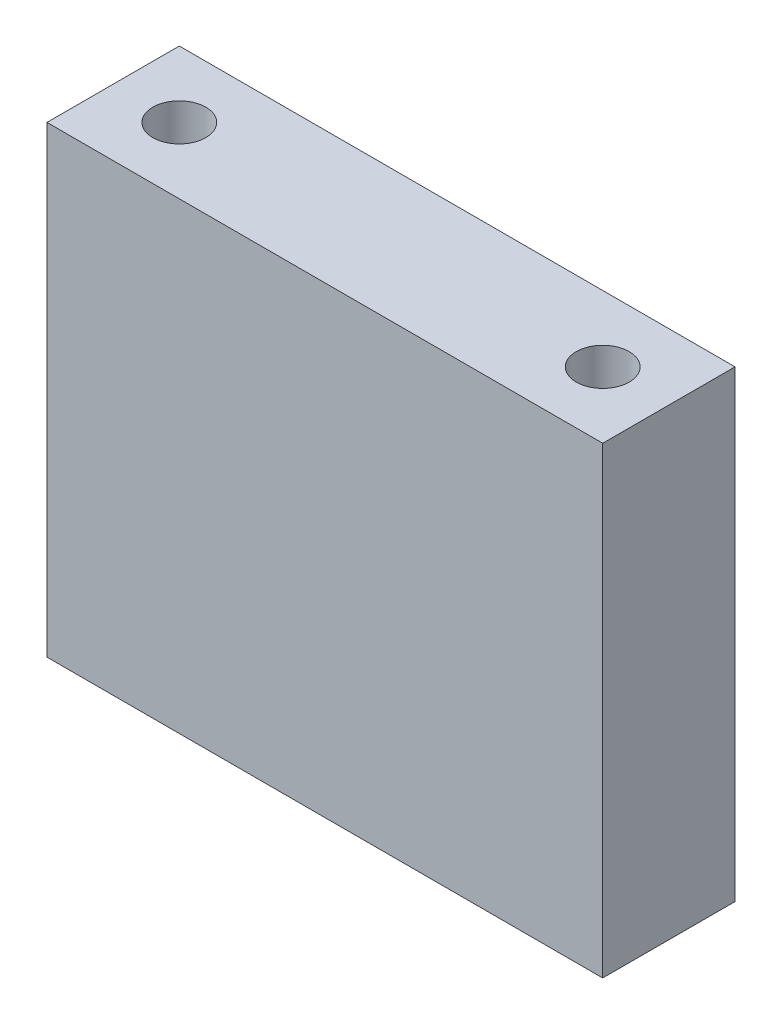
from build123d import *

# Parameters (mm, degrees)
SKETCH1_W           = 84
SKETCH1_H           = 20
SKETCH1_R           = 4
BOSS_EXTRUDE1_DEPTH = 70


with BuildPart() as part:
    # Sketch1 → Boss-Extrude1 (new body)
    with BuildSketch(Plane(origin=(0, 0, 0), x_dir=(1, 0, 0), z_dir=(0, 1, 0))):
        Rectangle(SKETCH1_W, SKETCH1_H)
        with Locations((-32, 0)):
            Circle(SKETCH1_R, mode=Mode.SUBTRACT)
        with Locations((32, 0)):
            Circle(SKETCH1_R, mode=Mode.SUBTRACT)
    extrude(amount=BOSS_EXTRUDE1_DEPTH)


solid = part.part
